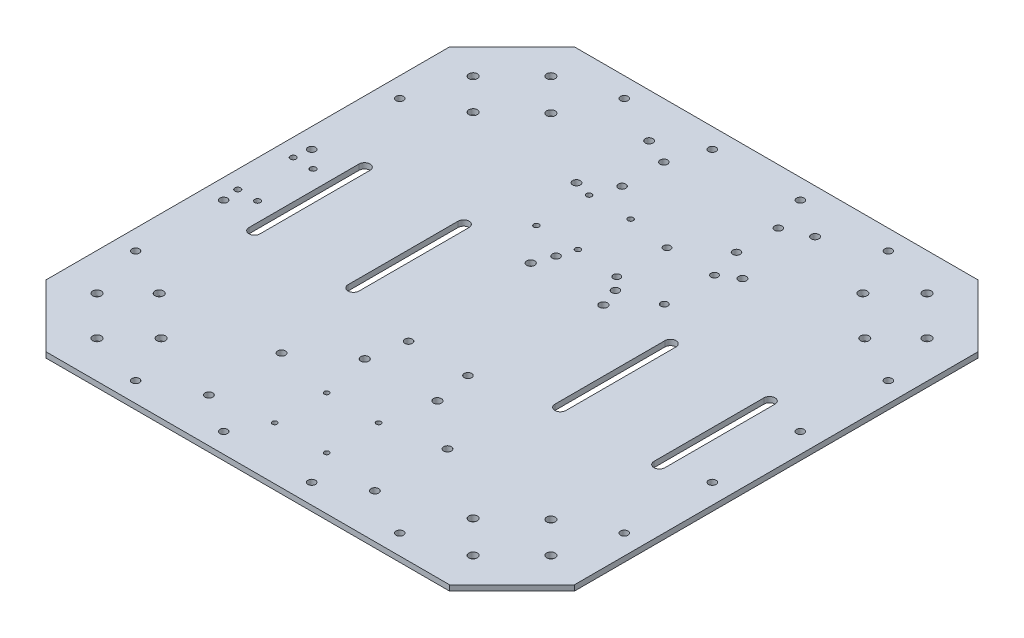
from build123d import *

# Parameters (mm, degrees)
BOSS_EXTRUDE1_DEPTH = 3.175
SKETCH2_R           = 2.4638
CUT_EXTRUDE1_DEPTH  = 6.35
SKETCH3_R           = 2.159
CUT_EXTRUDE2_DEPTH  = 6.35
SKETCH4_R           = 2.2225
SKETCH4_R_2         = 2.286
CUT_EXTRUDE3_DEPTH  = 351.937720963
SKETCH5_R           = 1.651
CUT_EXTRUDE4_DEPTH  = 351.937720963
SKETCH6_R           = 2.032
SKETCH6_R_2         = 2.159
SKETCH6_R_3         = 1.397
SKETCH6_R_4         = 1.5499969
CUT_EXTRUDE5_DEPTH  = 351.937720963
SKETCH7_R           = 2.159
CUT_EXTRUDE6_DEPTH  = 351.937720963
CUT_EXTRUDE8_DEPTH  = 351.937720963


with BuildPart() as part:
    # Sketch1 → Boss-Extrude1 (new body)
    with BuildSketch(Plane(origin=(0, 0, 0), x_dir=(1, 0, 0), z_dir=(0, 1, 0))):
        Polygon((-25.845025354, 51.656360067), (-61.766049839, 15.735335583), (-61.766049839, -217.222615449), (-25.845025354, -253.143639933), (207.112925677, -253.143639933), (243.033950161, -217.222615449), (243.033950161, 15.735335583), (207.112925677, 51.656360067), align=None)
    extrude(amount=BOSS_EXTRUDE1_DEPTH)

    # Sketch2 → Cut-Extrude1 (cut)
    with BuildSketch(Plane(origin=(0, 3.175, 0), x_dir=(1, 0, 0), z_dir=(0, 1, 0))):
        with Locations((-17.872380726, 30.213331256)):
            Circle(SKETCH2_R)
        with Locations((0.640891541, 11.70005899)):
            Circle(SKETCH2_R)
        with Locations((-22.362508786, -10.197821288)):
            Circle(SKETCH2_R)
        with Locations((-40.323021028, 7.762690954)):
            Circle(SKETCH2_R)
        with Locations((203.630409109, -10.197821288)):
            Circle(SKETCH2_R)
        with Locations((221.590921351, 7.762690954)):
            Circle(SKETCH2_R)
        with Locations((180.627008782, 11.70005899)):
            Circle(SKETCH2_R)
        with Locations((199.140281048, 30.213331256)):
            Circle(SKETCH2_R)
        with Locations((-22.362508786, -191.289458578)):
            Circle(SKETCH2_R)
        with Locations((-40.323021028, -209.24997082)):
            Circle(SKETCH2_R)
        with Locations((-17.872380726, -231.700611123)):
            Circle(SKETCH2_R)
        with Locations((0.640891541, -213.187338857)):
            Circle(SKETCH2_R)
        with Locations((221.590921351, -209.24997082)):
            Circle(SKETCH2_R)
        with Locations((199.140281048, -231.700611123)):
            Circle(SKETCH2_R)
        with Locations((180.627008782, -213.187338857)):
            Circle(SKETCH2_R)
        with Locations((203.630409109, -191.289458578)):
            Circle(SKETCH2_R)
    extrude(amount=-CUT_EXTRUDE1_DEPTH, mode=Mode.SUBTRACT)

    # Sketch3 → Cut-Extrude2 (cut)
    with BuildSketch(Plane(origin=(0, 3.175, 0), x_dir=(1, 0, 0), z_dir=(0, 1, 0))):
        with Locations((73.488950161, -58.198639933)):
            Circle(SKETCH3_R)
        with Locations((107.778950161, -58.198639933)):
            Circle(SKETCH3_R)
        with Locations((73.488950161, -143.288639933)):
            Circle(SKETCH3_R)
        with Locations((107.778950161, -143.288639933)):
            Circle(SKETCH3_R)
    extrude(amount=-CUT_EXTRUDE2_DEPTH, mode=Mode.SUBTRACT)

    # Sketch4 → Cut-Extrude3 (cut, through all)
    with BuildSketch(Plane(origin=(0, 3.175, 0), x_dir=(1, 0, 0), z_dir=(0, 1, 0))):
        with Locations((42.754950161, 26.256360067)):
            Circle(SKETCH4_R)
        with Locations((138.512950161, 26.256360067)):
            Circle(SKETCH4_R)
        with Locations((42.754950161, -15.653639933)):
            Circle(SKETCH4_R)
        with Locations((138.512950161, -15.653639933)):
            Circle(SKETCH4_R)
        with Locations((138.512950161, -185.833639933)):
            Circle(SKETCH4_R)
        with Locations((42.754950161, -185.833639933)):
            Circle(SKETCH4_R)
        with Locations((138.512950161, -227.743639933)):
            Circle(SKETCH4_R)
        with Locations((42.754950161, -227.743639933)):
            Circle(SKETCH4_R)
        with Locations((69.678950161, -68.993639933)):
            Circle(SKETCH4_R_2)
        with Locations((111.588950161, -68.993639933)):
            Circle(SKETCH4_R_2)
        with Locations((69.678950161, -164.751639933)):
            Circle(SKETCH4_R_2)
        with Locations((111.588950161, -164.751639933)):
            Circle(SKETCH4_R_2)
    extrude(amount=-CUT_EXTRUDE3_DEPTH, mode=Mode.SUBTRACT)

    # Sketch5 → Cut-Extrude4 (cut, through all)
    with BuildSketch(Plane(origin=(0, 3.175, 0), x_dir=(1, 0, 0), z_dir=(0, 1, 0))):
        with Locations((-51.606049839, -84.741639933)):
            Circle(SKETCH5_R)
        with Locations((-40.176049839, -84.741639933)):
            Circle(SKETCH5_R)
        with Locations((-40.176049839, -116.745639933)):
            Circle(SKETCH5_R)
        with Locations((-51.606049839, -116.745639933)):
            Circle(SKETCH5_R)
    extrude(amount=-CUT_EXTRUDE4_DEPTH, mode=Mode.SUBTRACT)

    # Sketch6 → Cut-Extrude5 (cut, through all)
    with BuildSketch(Plane(origin=(0, 3.175, 0), x_dir=(1, 0, 0), z_dir=(0, 1, 0))):
        with Locations((101.301950161, -22.003639933)):
            Circle(SKETCH6_R)
        with Locations((101.301950161, -50.959639933)):
            Circle(SKETCH6_R)
        with Locations((128.733950161, -50.959639933)):
            Circle(SKETCH6_R)
        with Locations((128.733950161, -22.003639933)):
            Circle(SKETCH6_R)
        with Locations((57.613950161, 19.906360067)):
            Circle(SKETCH6_R_2)
        with Locations((57.613950161, -4.223639933)):
            Circle(SKETCH6_R_2)
        with Locations((123.653950161, -4.223639933)):
            Circle(SKETCH6_R_2)
        with Locations((123.653950161, 19.906360067)):
            Circle(SKETCH6_R_2)
        with Locations((75.647950161, -192.691639933)):
            Circle(SKETCH6_R_3)
        with Locations((75.647950161, -222.663639933)):
            Circle(SKETCH6_R_3)
        with Locations((105.619950161, -222.663639933)):
            Circle(SKETCH6_R_3)
        with Locations((105.619950161, -192.691639933)):
            Circle(SKETCH6_R_3)
        with Locations((52.533950161, -18.193639933)):
            Circle(SKETCH6_R_4)
        with Locations((52.533950161, -48.593629933)):
            Circle(SKETCH6_R_4)
        with Locations((76.533952961, -18.193639933)):
            Circle(SKETCH6_R_4)
        with Locations((76.533952961, -48.593629933)):
            Circle(SKETCH6_R_4)
    extrude(amount=-CUT_EXTRUDE5_DEPTH, mode=Mode.SUBTRACT)

    # Sketch7 → Cut-Extrude6 (cut, through all)
    with BuildSketch(Plane(origin=(0, 3.175, 0), x_dir=(1, 0, 0), z_dir=(0, 1, 0))):
        with Locations((65.233950161, 40.226360067)):
            Circle(SKETCH7_R)
        with Locations((14.433950161, 40.226360067)):
            Circle(SKETCH7_R)
        with Locations((-50.336049839, -75.343639933)):
            Circle(SKETCH7_R)
        with Locations((-50.336049839, -24.543639933)):
            Circle(SKETCH7_R)
        with Locations((231.603950161, -24.543639933)):
            Circle(SKETCH7_R)
        with Locations((231.603950161, -75.343639933)):
            Circle(SKETCH7_R)
        with Locations((166.833950161, 40.226360067)):
            Circle(SKETCH7_R)
        with Locations((116.033950161, 40.226360067)):
            Circle(SKETCH7_R)
        with Locations((116.033950161, -241.713639933)):
            Circle(SKETCH7_R)
        with Locations((166.833950161, -241.713639933)):
            Circle(SKETCH7_R)
        with Locations((231.603950161, -126.143639933)):
            Circle(SKETCH7_R)
        with Locations((231.603950161, -176.943639933)):
            Circle(SKETCH7_R)
        with Locations((-50.336049839, -176.943639933)):
            Circle(SKETCH7_R)
        with Locations((-50.336049839, -126.143639933)):
            Circle(SKETCH7_R)
        with Locations((14.433950161, -241.713639933)):
            Circle(SKETCH7_R)
        with Locations((65.233950161, -241.713639933)):
            Circle(SKETCH7_R)
    extrude(amount=-CUT_EXTRUDE6_DEPTH, mode=Mode.SUBTRACT)

    # Sketch8 → Cut-Extrude8 (cut, through all)
    with BuildSketch(Plane(origin=(0, 3.175, 0), x_dir=(1, 0, 0), z_dir=(0, 1, 0))):
        with BuildLine():
            Line((-23.031049839, -68.993639933), (-23.031049839, -132.493639933))
            ThreePointArc((-23.031049839, -132.493639933), (-26.206049839, -135.668639933), (-29.381049839, -132.493639933))
            Line((-29.381049839, -132.493639933), (-29.381049839, -68.993639933))
            ThreePointArc((-29.381049839, -68.993639933), (-26.206049839, -65.818639933), (-23.031049839, -68.993639933))
        make_face()
        with BuildLine():
            Line((34.118950161, -68.993639933), (34.118950161, -132.493639933))
            ThreePointArc((34.118950161, -132.493639933), (30.943950161, -135.668639933), (27.768950161, -132.493639933))
            Line((27.768950161, -132.493639933), (27.768950161, -68.993639933))
            ThreePointArc((27.768950161, -68.993639933), (30.943950161, -65.818639933), (34.118950161, -68.993639933))
        make_face()
        with BuildLine():
            Line((204.298950161, -68.993639933), (204.298950161, -132.493639933))
            ThreePointArc((204.298950161, -132.493639933), (207.473950161, -135.668639933), (210.648950161, -132.493639933))
            Line((210.648950161, -132.493639933), (210.648950161, -68.993639933))
            ThreePointArc((210.648950161, -68.993639933), (207.473950161, -65.818639933), (204.298950161, -68.993639933))
        make_face()
        with BuildLine():
            Line((147.148950161, -68.993639933), (147.148950161, -132.493639933))
            ThreePointArc((147.148950161, -132.493639933), (150.323950161, -135.668639933), (153.498950161, -132.493639933))
            Line((153.498950161, -132.493639933), (153.498950161, -68.993639933))
            ThreePointArc((153.498950161, -68.993639933), (150.323950161, -65.818639933), (147.148950161, -68.993639933))
        make_face()
    extrude(amount=-CUT_EXTRUDE8_DEPTH, mode=Mode.SUBTRACT)


solid = part.part
